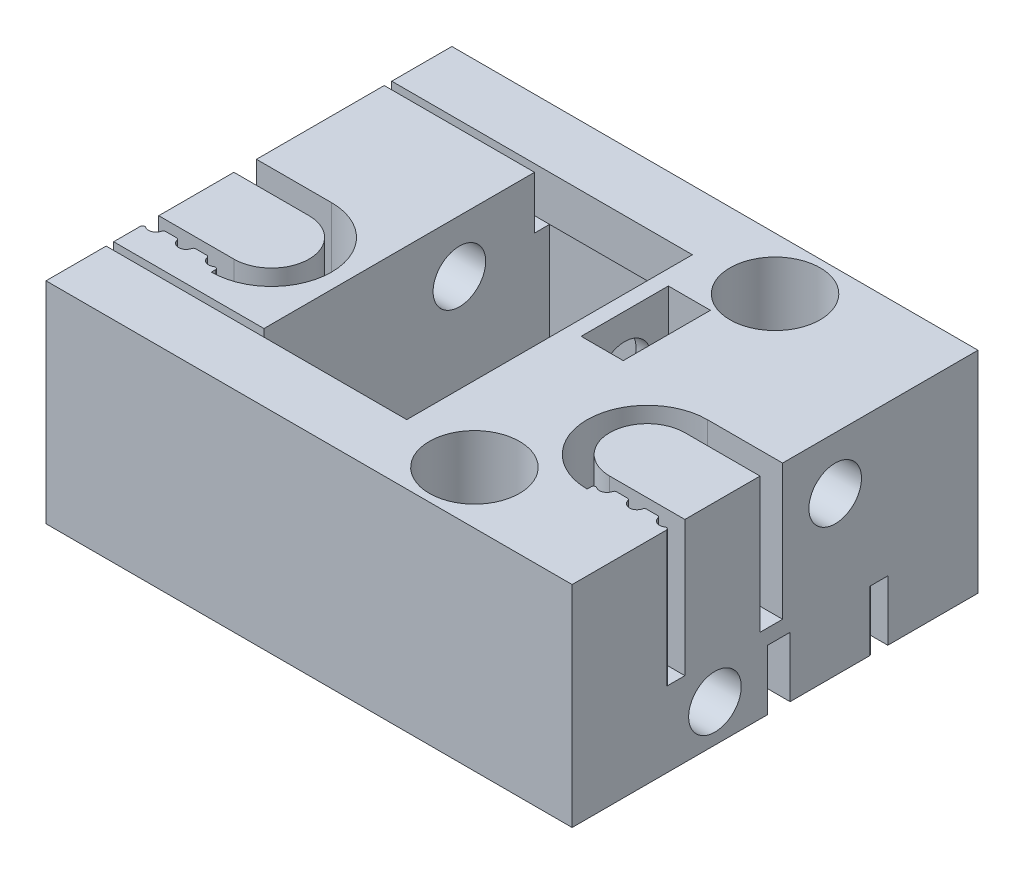
from build123d import *

# Parameters (mm, degrees)
SKETCH1_W                = 35
SKETCH1_H                = 27
BOSS_EXTRUDE1_DEPTH      = 14
SKETCH2_R                = 1.75
CUT_EXTRUDE1_DEPTH       = 14
SKETCH9_R                = 3
CUT_EXTRUDE7_DEPTH       = 10
CUT_EXTRUDE10_DEPTH      = 10
CUT_EXTRUDE11_DEPTH      = 27.162950904
CUT_EXTRUDE11_DEPTH_BACK = 27.162950904
SKETCH13_W               = 10
SKETCH13_H               = 19
SKETCH31_W               = 1
SKETCH31_H               = 8
CUT_EXTRUDE21_DEPTH      = 10
SKETCH15_W               = 5
SKETCH15_H               = 2
CUT_EXTRUDE12_DEPTH      = 27.162950904
CUT_EXTRUDE13_DEPTH      = 9
SKETCH18_R               = 0.5
CUT_EXTRUDE15_DEPTH      = 9
LPATTERN2_COUNT          = 3
LPATTERN2_PITCH          = 2
FILLET1_R                = 0.15
CUT_EXTRUDE14_DEPTH      = 4
SKETCH19_R               = 0.5
CUT_EXTRUDE16_DEPTH      = 4
LPATTERN3_COUNT          = 3
LPATTERN3_PITCH          = 2
FILLET2_START            = -1
FILLET2_DEPTH            = 5
SKETCH20_R               = 1.75
CUT_EXTRUDE17_DEPTH      = 40
SKETCH26_R               = 2.9
CUT_EXTRUDE18_DEPTH      = 5
BOSS_EXTRUDE3_DEPTH      = 5
MIRROR1_START            = 5
MIRROR1_DEPTH            = 9
MIRROR1_2_DEPTH          = 4
SKETCH29_W               = 2.8
SKETCH29_H               = 5.8
CUT_EXTRUDE19_DEPTH      = 6.8
SKETCH30_W               = 2.8
SKETCH30_H               = 5.8
CUT_EXTRUDE20_DEPTH      = 5.8


with BuildPart() as part:
    # Sketch1 → Boss-Extrude1 (new body)
    with BuildSketch(Plane(origin=(0, 0, 0), x_dir=(1, 0, 0), z_dir=(0, 1, 0))):
        Rectangle(SKETCH1_W, SKETCH1_H)
    extrude(amount=BOSS_EXTRUDE1_DEPTH)

    # Sketch2 → Cut-Extrude1 (cut)
    with BuildSketch(Plane(origin=(0, 14, 0), x_dir=(1, 0, 0), z_dir=(0, 1, 0))):
        with Locations(Location((7.5, -10, 0), (0, 0, 270))):
            Circle(SKETCH2_R)
        with Locations(Location((7.5, 10, 0), (0, 0, 270))):
            Circle(SKETCH2_R)
    extrude(amount=-CUT_EXTRUDE1_DEPTH, mode=Mode.SUBTRACT)

    # Sketch9 → Cut-Extrude7 (cut)
    with BuildSketch(Plane(origin=(0, 14, 0), x_dir=(1, 0, 0), z_dir=(0, 1, 0))):
        with Locations(Location((7.5, 10, 0), (0, 0, 270))):
            Circle(SKETCH9_R)
        with Locations(Location((7.5, -10, 0), (0, 0, 270))):
            Circle(SKETCH9_R)
    extrude(amount=-CUT_EXTRUDE7_DEPTH, mode=Mode.SUBTRACT)

    # Sketch12 → Cut-Extrude10 (cut)
    with BuildSketch(Plane.ZY.offset(17.5)):
        Polygon((-9.5, 14), (-9.5, 11), (-10.5, 11), (-10.5, 3), (-9.5, 3), (-9.5, 0), (-9, 0), (-9, 3.5), (-10, 3.5), (-10, 10.5), (-9, 10.5), (-9, 14), align=None)
        Polygon((10, 10.5), (10, 3.5), (9, 3.5), (9, 0), (9.5, 0), (9.5, 3), (10.5, 3), (10.5, 11), (9.5, 11), (9.5, 14), (9, 14), (9, 10.5), align=None)
    extrude(amount=-CUT_EXTRUDE10_DEPTH, mode=Mode.SUBTRACT)

    # Sketch13 → Cut-Extrude11 (cut, two sides: drawn at the far end of the back side and taken through both)
    with BuildSketch(Plane(origin=(0, 14, 0), x_dir=(1, 0, 0), z_dir=(0, 1, 0)).offset(-CUT_EXTRUDE11_DEPTH_BACK)):
        with Locations((-2.5, 0)):
            Rectangle(SKETCH13_W, SKETCH13_H)
    extrude(amount=CUT_EXTRUDE11_DEPTH + CUT_EXTRUDE11_DEPTH_BACK, mode=Mode.SUBTRACT)

    # Sketch31 → Cut-Extrude21 (cut)
    with BuildSketch(Plane.ZY.offset(7.5)):
        with Locations((-10, 7)):
            Rectangle(SKETCH31_W, SKETCH31_H)
        with Locations((10, 7)):
            Rectangle(SKETCH31_W, SKETCH31_H)
    extrude(amount=-CUT_EXTRUDE21_DEPTH, mode=Mode.SUBTRACT)


with BuildPart() as cut_extrude21_piece_1:
    # of the separate pieces the step leaves, piece 1, a body of its own (cut_extrude21_pieces)
    add(part.part.solids().sort_by_distance((-17.5, 0, -13.5))[0])


with BuildPart() as cut_extrude21_piece_2:
    # of the separate pieces the step leaves, piece 2, a body of its own (cut_extrude21_pieces)
    add(part.part.solids().sort_by_distance((-7.5, 14, 9))[0])

    # Sketch15 → Cut-Extrude12 (cut, through all)
    with BuildSketch(Plane(origin=(0, 14, 0), x_dir=(1, 0, 0), z_dir=(0, 1, 0))):
        with Locations((-15, 0)):
            Rectangle(SKETCH15_W, SKETCH15_H)
    extrude(amount=-CUT_EXTRUDE12_DEPTH, mode=Mode.SUBTRACT)

    # Sketch16 → Cut-Extrude13 (cut)
    with BuildSketch(Plane(origin=(0, 14, 0), x_dir=(1, 0, 0), z_dir=(0, 1, 0))):
        with BuildLine():
            Line((-12.5, -6), (-17.5, -6))
            Line((-17.5, -6), (-17.5, -6.68))
            Line((-17.5, -6.68), (-12.5, -6.68))
            Line((-12.5, -6.68), (-12.5, -7.5))
            ThreePointArc((-12.5, -7.5), (-8.5, -3.5), (-12.5, 0.5))
            Line((-12.5, 0.5), (-12.5, -1))
            ThreePointArc((-12.5, -1), (-10, -3.5), (-12.5, -6))
        make_face()
    extrude(amount=-CUT_EXTRUDE13_DEPTH, mode=Mode.SUBTRACT)

    # Sketch18 → Cut-Extrude15 (cut)
    with BuildSketch(Plane(origin=(0, 14, 0), x_dir=(1, 0, 0), z_dir=(0, 1, 0))):
        with Locations((-13, -6.68)):
            Circle(SKETCH18_R)
    cut_extrude15 = extrude(amount=-CUT_EXTRUDE15_DEPTH, mode=Mode.SUBTRACT)

    # LPattern2: Cut-Extrude15 ×3
    with Locations(*[(-i * LPATTERN2_PITCH, 0, 0) for i in range(1, LPATTERN2_COUNT)]):
        add(cut_extrude15, mode=Mode.SUBTRACT)

    # Fillet1
    fillet1_edges = [cut_extrude21_piece_2.edges().sort_by_distance(p)[0] for p in [
        (-12.5, 9.5, 6.68),
        (-17.5, 9.5, 6.68),
        (-13.5, 9.5, 6.68),
        (-14.5, 9.5, 6.68),
        (-15.5, 9.5, 6.68),
        (-16.5, 9.5, 6.68),
    ]]
    fillet(fillet1_edges, radius=FILLET1_R)

    # Sketch17 → Cut-Extrude14 (cut)
    with BuildSketch(Plane.XZ):
        with BuildLine():
            Line((-12.5, -7.5), (-17.5, -7.5))
            Line((-17.5, -7.5), (-17.5, -6.82))
            Line((-17.5, -6.82), (-12.5, -6.82))
            Line((-12.5, -6.82), (-12.5, -6))
            ThreePointArc((-12.5, -6), (-10, -3.5), (-12.5, -1))
            Line((-12.5, -1), (-12.5, 0.5))
            ThreePointArc((-12.5, 0.5), (-8.5, -3.5), (-12.5, -7.5))
        make_face()
    extrude(amount=-CUT_EXTRUDE14_DEPTH, mode=Mode.SUBTRACT)

    # Sketch19 → Cut-Extrude16 (cut)
    with BuildSketch(Plane.XZ):
        with Locations((-13, -6.82)):
            Circle(SKETCH19_R)
    cut_extrude16 = extrude(amount=-CUT_EXTRUDE16_DEPTH, mode=Mode.SUBTRACT)

    # LPattern3: Cut-Extrude16 ×3
    with Locations(*[(-i * LPATTERN3_PITCH, 0, 0) for i in range(1, LPATTERN3_COUNT)]):
        add(cut_extrude16, mode=Mode.SUBTRACT)

    # Fillet2: read off the stored shape, not the designer's step
    # Fillet2 outline → Fillet2 (cut)
    with BuildSketch(Plane(origin=(0, 0, 0), x_dir=(1, 0, 0), z_dir=(0, 1, 0)).offset(FILLET2_START)):
        with BuildLine():
            Line((-17.5, 6.82), (-17.5, 6.272277442))
            ThreePointArc((-17.5, 6.272277442), (-17.422057669, 6.403836145), (-17.269230769, 6.398674956))
            ThreePointArc((-17.269230769, 6.398674956), (-17.43852901, 6.579807769), (-17.5, 6.82))
        make_face()
        with BuildLine():
            ThreePointArc((-12.5, 6.82), (-12.56147099, 6.579807769), (-12.730769231, 6.398674956))
            ThreePointArc((-12.730769231, 6.398674956), (-12.577942331, 6.403836145), (-12.5, 6.272277442))
            Line((-12.5, 6.272277442), (-12.5, 6.82))
        make_face()
        with BuildLine():
            Line((-13.5, 6.82), (-13.632455532, 6.82))
            ThreePointArc((-13.632455532, 6.82), (-13.539429481, 6.787669681), (-13.486504255, 6.704615385))
            ThreePointArc((-13.486504255, 6.704615385), (-13.496614603, 6.761914407), (-13.5, 6.82))
        make_face()
        with BuildLine():
            ThreePointArc((-14.5, 6.82), (-14.503385397, 6.761914407), (-14.513495745, 6.704615385))
            ThreePointArc((-14.513495745, 6.704615385), (-14.460570519, 6.787669681), (-14.367544468, 6.82))
            Line((-14.367544468, 6.82), (-14.5, 6.82))
        make_face()
        with BuildLine():
            Line((-15.5, 6.82), (-15.632455532, 6.82))
            ThreePointArc((-15.632455532, 6.82), (-15.539429481, 6.787669681), (-15.486504255, 6.704615385))
            ThreePointArc((-15.486504255, 6.704615385), (-15.496614603, 6.761914407), (-15.5, 6.82))
        make_face()
        with BuildLine():
            ThreePointArc((-16.5, 6.82), (-16.503385397, 6.761914407), (-16.513495745, 6.704615385))
            ThreePointArc((-16.513495745, 6.704615385), (-16.460570519, 6.787669681), (-16.367544468, 6.82))
            Line((-16.367544468, 6.82), (-16.5, 6.82))
        make_face()
    extrude(amount=FILLET2_DEPTH, mode=Mode.SUBTRACT)


with BuildPart() as cut_extrude17_tool:
    # Sketch20 → Cut-Extrude17 (new body)
    with BuildSketch(Plane.ZY.offset(17.5)):
        with Locations((-4, 10.5)):
            Circle(SKETCH20_R)
        with Locations((4, 2.5)):
            Circle(SKETCH20_R)
    extrude(amount=-CUT_EXTRUDE17_DEPTH)


with BuildPart() as cut_extrude21_piece_1_1:
    add(cut_extrude21_piece_1.part)

    # Cut-Extrude17: cut by cut_extrude17_tool
    add(cut_extrude17_tool.part, mode=Mode.SUBTRACT)

    # Mirror1: read off the stored shape, not the designer's step
    # Mirror1 outline → Mirror1 (cut)
    with BuildSketch(Plane(origin=(0, 0, 0), x_dir=(1, 0, 0), z_dir=(0, 1, 0)).offset(MIRROR1_START)):
        with BuildLine():
            ThreePointArc((13.486504255, -6.795384615), (13.539429481, -6.712330319), (13.632455532, -6.68))
            Line((13.632455532, -6.68), (14.367544468, -6.68))
            ThreePointArc((14.367544468, -6.68), (14.460570519, -6.712330319), (14.513495745, -6.795384615))
            ThreePointArc((14.513495745, -6.795384615), (15, -7.18), (15.486504255, -6.795384615))
            ThreePointArc((15.486504255, -6.795384615), (15.539429481, -6.712330319), (15.632455532, -6.68))
            Line((15.632455532, -6.68), (16.367544468, -6.68))
            ThreePointArc((16.367544468, -6.68), (16.460570519, -6.712330319), (16.513495745, -6.795384615))
            ThreePointArc((16.513495745, -6.795384615), (16.812378497, -7.143463236), (17.269230769, -7.101325044))
            ThreePointArc((17.269230769, -7.101325044), (17.422057669, -7.096163855), (17.5, -7.227722558))
            Line((17.5, -7.227722558), (17.5, -6))
            Line((17.5, -6), (12.5, -6))
            ThreePointArc((12.5, -6), (10, -3.5), (12.5, -1))
            Line((12.5, -1), (17.5, -1))
            Line((17.5, -1), (17.5, 0.5))
            Line((17.5, 0.5), (12.5, 0.5))
            ThreePointArc((12.5, 0.5), (8.5, -3.5), (12.5, -7.5))
            Line((12.5, -7.5), (12.5, -7.227722558))
            ThreePointArc((12.5, -7.227722558), (12.577942331, -7.096163855), (12.730769231, -7.101325044))
            ThreePointArc((12.730769231, -7.101325044), (13.187621503, -7.143463236), (13.486504255, -6.795384615))
        make_face()
    extrude(amount=MIRROR1_DEPTH, mode=Mode.SUBTRACT)

    # Mirror1 2 outline → Mirror1 2 (cut)
    with BuildSketch(Plane(origin=(0, 0, 0), x_dir=(1, 0, 0), z_dir=(0, 1, 0))):
        with BuildLine():
            ThreePointArc((12.5, 7.5), (8.5, 3.5), (12.5, -0.5))
            Line((12.5, -0.5), (17.5, -0.5))
            Line((17.5, -0.5), (17.5, 1))
            Line((17.5, 1), (12.5, 1))
            ThreePointArc((12.5, 1), (10, 3.5), (12.5, 6))
            Line((12.5, 6), (12.5, 6.272277442))
            ThreePointArc((12.5, 6.272277442), (12.577942331, 6.403836145), (12.730769231, 6.398674956))
            ThreePointArc((12.730769231, 6.398674956), (13.187621503, 6.356536764), (13.486504255, 6.704615385))
            ThreePointArc((13.486504255, 6.704615385), (13.539429481, 6.787669681), (13.632455532, 6.82))
            Line((13.632455532, 6.82), (14.367544468, 6.82))
            ThreePointArc((14.367544468, 6.82), (14.460570519, 6.787669681), (14.513495745, 6.704615385))
            ThreePointArc((14.513495745, 6.704615385), (15, 6.32), (15.486504255, 6.704615385))
            ThreePointArc((15.486504255, 6.704615385), (15.539429481, 6.787669681), (15.632455532, 6.82))
            Line((15.632455532, 6.82), (16.367544468, 6.82))
            ThreePointArc((16.367544468, 6.82), (16.460570519, 6.787669681), (16.513495745, 6.704615385))
            ThreePointArc((16.513495745, 6.704615385), (16.812378497, 6.356536764), (17.269230769, 6.398674956))
            ThreePointArc((17.269230769, 6.398674956), (17.422057669, 6.403836145), (17.5, 6.272277442))
            Line((17.5, 6.272277442), (17.5, 7.5))
            Line((17.5, 7.5), (12.5, 7.5))
        make_face()
    extrude(amount=MIRROR1_2_DEPTH, mode=Mode.SUBTRACT)

    # Sketch29 → Cut-Extrude19 (cut)
    with BuildSketch(Plane(origin=(0, 14, 0), x_dir=(1, 0, 0), z_dir=(0, 1, 0))):
        with Locations((4.9, 4)):
            Rectangle(SKETCH29_W, SKETCH29_H)
    extrude(amount=-CUT_EXTRUDE19_DEPTH, mode=Mode.SUBTRACT)

    # Sketch30 → Cut-Extrude20 (cut)
    with BuildSketch(Plane.XZ):
        with Locations((4.9, 4)):
            Rectangle(SKETCH30_W, SKETCH30_H)
    extrude(amount=-CUT_EXTRUDE20_DEPTH, mode=Mode.SUBTRACT)


with BuildPart() as cut_extrude21_piece_2_1:
    add(cut_extrude21_piece_2.part)

    # Cut-Extrude17: cut by cut_extrude17_tool
    add(cut_extrude17_tool.part, mode=Mode.SUBTRACT)

    # Sketch26 → Cut-Extrude18 (cut)
    with BuildSketch(Plane.ZY.offset(17.5)):
        with Locations((-4, 10.5)):
            Circle(SKETCH26_R)
        with Locations((4, 2.5)):
            Circle(SKETCH26_R)
    extrude(amount=-CUT_EXTRUDE18_DEPTH, mode=Mode.SUBTRACT)

    # Sketch28 → Boss-Extrude3 (add)
    with BuildSketch(Plane.ZY.offset(12.5)):
        Polygon((-1, 14), (-1, 4), (0.5, 4), (0.5, 0), (1, 0), (1, 5), (-0.5, 5), (-0.5, 14), align=None)
    extrude(amount=BOSS_EXTRUDE3_DEPTH)


solid = Compound([cut_extrude21_piece_1_1.part, cut_extrude21_piece_2_1.part])
